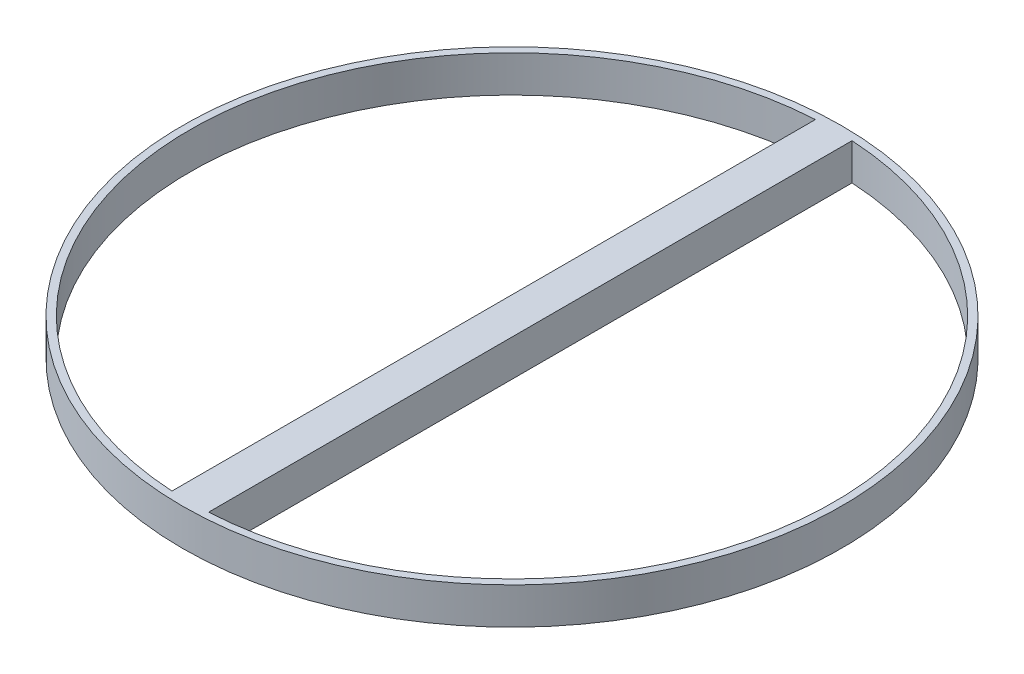
from build123d import *

# Parameters (mm, degrees)
SKETCH1_R           = 90
BOSS_EXTRUDE2_DEPTH = 10


with BuildPart() as part:
    # Sketch1 → Boss-Extrude2 (new body)
    with BuildSketch(Plane(origin=(0, 0, 0), x_dir=(1, 0, 0), z_dir=(0, 1, 0))):
        Circle(SKETCH1_R)
        with BuildLine():
            Line((-5, 87.857839718), (-5, -87.857839718))
            ThreePointArc((-5, -87.857839718), (-88, 0), (-5, 87.857839718))
        make_face(mode=Mode.SUBTRACT)
        with BuildLine():
            Line((5, 87.857839718), (5, -87.857839718))
            ThreePointArc((5, -87.857839718), (88, 0), (5, 87.857839718))
        make_face(mode=Mode.SUBTRACT)
    extrude(amount=BOSS_EXTRUDE2_DEPTH)


solid = part.part
